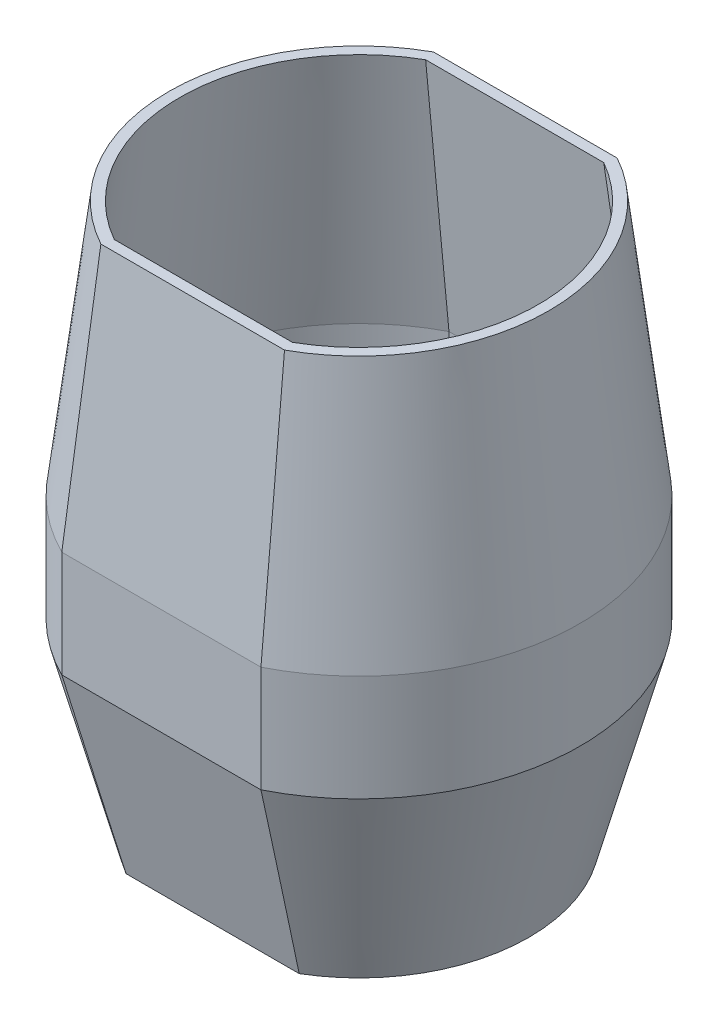
from build123d import *

# Parameters (mm, degrees)
BOSS_EXTRUDE1_DEPTH = 90
BOSS_EXTRUDE1_DRAFT = -15
CUT_EXTRUDE1_DEPTH  = 90
CUT_EXTRUDE1_DRAFT  = -15
BOSS_EXTRUDE3_DEPTH = 50
BOSS_EXTRUDE4_DEPTH = 120
BOSS_EXTRUDE4_DRAFT = 7
CUT_EXTRUDE2_DEPTH  = 160
CUT_EXTRUDE2_DRAFT  = 7


with BuildPart() as part:
    # Sketch1 → Boss-Extrude1 (with draft: the straight prism first)
    with BuildSketch(Plane(origin=(0, 0, 0), x_dir=(1, 0, 0), z_dir=(0, 1, 0))):
        with BuildLine():
            ThreePointArc((-40.713913342, 68.86492039), (-80, 0), (-40.713913342, -68.86492039))
            Line((-40.713913342, -68.86492039), (40.713913342, -68.86492039))
            ThreePointArc((40.713913342, -68.86492039), (80, 0), (40.713913342, 68.86492039))
            Line((40.713913342, 68.86492039), (-40.713913342, 68.86492039))
        make_face()
    extrude(amount=BOSS_EXTRUDE1_DEPTH)
    # Boss-Extrude1: the draft: its side faces are tilted about the plane it starts from
    boss_extrude1_sides = [part.faces().sort_by_distance(p)[0] for p in [
        (-80, 45, 0),
        (0, 45, 68.86492039),
        (80, 45, 0),
        (0, 45, -68.86492039),
    ]]
    draft(boss_extrude1_sides, Plane(origin=(0, 0, 0), x_dir=(1, 0, 0), z_dir=(0, 1, 0)), BOSS_EXTRUDE1_DRAFT)


with BuildPart() as cut_extrude1_tool:
    # Sketch1<4> → Cut-Extrude1 (with draft: the straight prism first)
    with BuildSketch(Plane(origin=(0, 0, 0), x_dir=(1, 0, 0), z_dir=(0, 1, 0))):
        with BuildLine():
            Line((-39.322664502, -63.86492039), (39.322664502, -63.86492039))
            ThreePointArc((39.322664502, -63.86492039), (75, 0), (39.322664502, 63.86492039))
            Line((39.322664502, 63.86492039), (-39.322664502, 63.86492039))
            ThreePointArc((-39.322664502, 63.86492039), (-75, 0), (-39.322664502, -63.86492039))
        make_face()
    extrude(amount=CUT_EXTRUDE1_DEPTH)
    # Cut-Extrude1: the draft: its side faces are tilted about the plane it starts from
    cut_extrude1_sides = [cut_extrude1_tool.faces().sort_by_distance(p)[0] for p in [
        (0, 45, 63.86492039),
        (75, 45, 0),
        (0, 45, -63.86492039),
        (-75, 45, 0),
    ]]
    draft(cut_extrude1_sides, Plane(origin=(0, 0, 0), x_dir=(1, 0, 0), z_dir=(0, 1, 0)), CUT_EXTRUDE1_DRAFT)


with BuildPart() as part_1:
    add(part.part)

    # Cut-Extrude1: cut by cut_extrude1_tool
    add(cut_extrude1_tool.part, mode=Mode.SUBTRACT)

    # Sketch3 → Boss-Extrude3 (add)
    with BuildSketch(Plane(origin=(0, 90, 0), x_dir=(1, 0, 0), z_dir=(0, 1, 0))):
        with BuildLine():
            Line((-46.847381417, -92.980347709), (46.847381417, -92.980347709))
            ThreePointArc((46.847381417, -92.980347709), (104.115427319, 0), (46.847381417, 92.980347709))
            Line((46.847381417, 92.980347709), (-46.847381417, 92.980347709))
            ThreePointArc((-46.847381417, 92.980347709), (-104.115427319, 0), (-46.847381417, -92.980347709))
        make_face()
        with BuildLine():
            Line((-45.643469955, -87.980347709), (45.643469955, -87.980347709))
            ThreePointArc((45.643469955, -87.980347709), (99.115427319, 0), (45.643469955, 87.980347709))
            Line((45.643469955, 87.980347709), (-45.643469955, 87.980347709))
            ThreePointArc((-45.643469955, 87.980347709), (-99.115427319, 0), (-45.643469955, -87.980347709))
        make_face(mode=Mode.SUBTRACT)
    extrude(amount=BOSS_EXTRUDE3_DEPTH)


with BuildPart() as boss_extrude4_tool:
    # Sketch4 → Boss-Extrude4 (with draft: the straight prism first)
    with BuildSketch(Plane(origin=(0, 140, 0), x_dir=(1, 0, 0), z_dir=(0, 1, 0))):
        with BuildLine():
            Line((46.847381417, 92.980347709), (-46.847381417, 92.980347709))
            ThreePointArc((-46.847381417, 92.980347709), (-104.115427319, 0), (-46.847381417, -92.980347709))
            Line((-46.847381417, -92.980347709), (46.847381417, -92.980347709))
            ThreePointArc((46.847381417, -92.980347709), (104.115427319, 0), (46.847381417, 92.980347709))
        make_face()
    extrude(amount=BOSS_EXTRUDE4_DEPTH)
    # Boss-Extrude4: the draft: its side faces are tilted about the plane it starts from
    boss_extrude4_sides = [boss_extrude4_tool.faces().sort_by_distance(p)[0] for p in [
        (104.115427319, 200, 0),
        (0, 200, -92.980347709),
        (-104.115427319, 200, 0),
        (0, 200, 92.980347709),
    ]]
    draft(boss_extrude4_sides, Plane(origin=(0, 140, 0), x_dir=(1, 0, 0), z_dir=(0, 1, 0)), BOSS_EXTRUDE4_DRAFT)


with BuildPart() as part_2:
    add(part_1.part)

    # Boss-Extrude4: add boss_extrude4_tool
    add(boss_extrude4_tool.part)


with BuildPart() as cut_extrude2_tool:
    # Sketch4<3> → Cut-Extrude2 (with draft: the straight prism first)
    with BuildSketch(Plane(origin=(0, 140, 0), x_dir=(1, 0, 0), z_dir=(0, 1, 0))):
        with BuildLine():
            Line((-45.643469955, -87.980347709), (45.643469955, -87.980347709))
            ThreePointArc((45.643469955, -87.980347709), (99.115427319, 0), (45.643469955, 87.980347709))
            Line((45.643469955, 87.980347709), (-45.643469955, 87.980347709))
            ThreePointArc((-45.643469955, 87.980347709), (-99.115427319, 0), (-45.643469955, -87.980347709))
        make_face()
    extrude(amount=CUT_EXTRUDE2_DEPTH)
    # Cut-Extrude2: the draft: its side faces are tilted about the plane it starts from
    cut_extrude2_sides = [cut_extrude2_tool.faces().sort_by_distance(p)[0] for p in [
        (0, 220, 87.980347709),
        (99.115427319, 220, 0),
        (0, 220, -87.980347709),
        (-99.115427319, 220, 0),
    ]]
    draft(cut_extrude2_sides, Plane(origin=(0, 140, 0), x_dir=(1, 0, 0), z_dir=(0, 1, 0)), CUT_EXTRUDE2_DRAFT)


with BuildPart() as part_3:
    add(part_2.part)

    # Cut-Extrude2: cut by cut_extrude2_tool
    add(cut_extrude2_tool.part, mode=Mode.SUBTRACT)


solid = part_3.part
